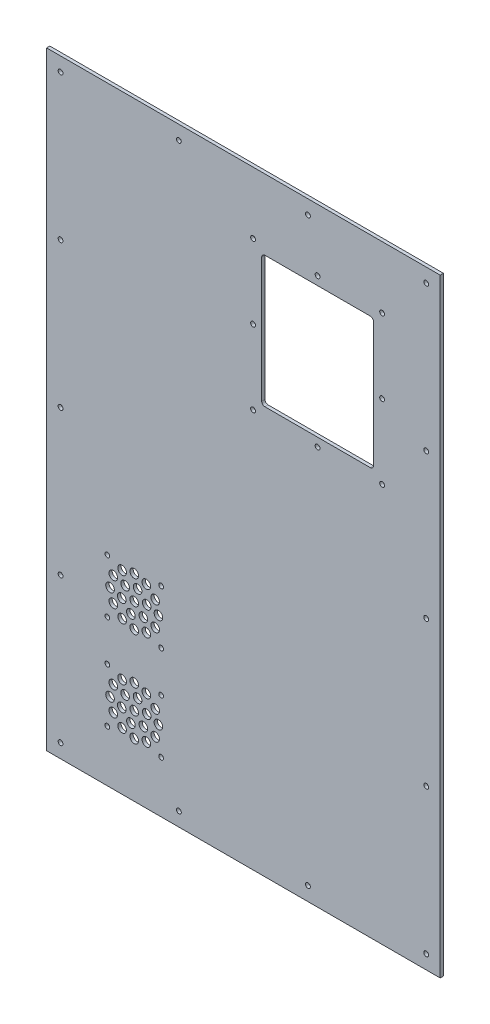
from build123d import *

# Parameters (mm, degrees)
SKETCH_1_W          = 366
SKETCH_1_H          = 566
EXTRUDE_1_DEPTH     = 3
SKETCH_5_R          = 2.25
CUT_EXTRUDE_2_DEPTH = 675.033381963
SKETCH_6_W          = 104
SKETCH_6_H          = 122
CUT_EXTRUDE_3_DEPTH = 675.033381963
SKETCH_7_R          = 2.25
CUT_EXTRUDE_4_DEPTH = 675.033381963
FILLET2_R           = 3
SKETCH_8_R          = 4
SKETCH_8_R_2        = 2.2
CUT_EXTRUDE_5_DEPTH = 675.033381963


with BuildPart() as part:
    # Эскиз1 → Бобышка-Вытянуть1 (new body)
    with BuildSketch(Plane.XY):
        with Locations((183, 283)):
            Rectangle(SKETCH_1_W, SKETCH_1_H)
    extrude(amount=EXTRUDE_1_DEPTH)

    # Эскиз5 → Вырез-Вытянуть2 (cut, through all)
    with BuildSketch(Plane(origin=(0, 0, 0), x_dir=(-1, 0, 0), z_dir=(0, 0, -1))):
        with Locations((-353, 553)):
            Circle(SKETCH_5_R)
        with Locations((-13, 553)):
            Circle(SKETCH_5_R)
        with Locations((-243, 553)):
            Circle(SKETCH_5_R)
        with Locations((-123, 553)):
            Circle(SKETCH_5_R)
        with Locations((-353, 418)):
            Circle(SKETCH_5_R)
        with Locations((-353, 283)):
            Circle(SKETCH_5_R)
        with Locations((-353, 148)):
            Circle(SKETCH_5_R)
        with Locations((-353, 13)):
            Circle(SKETCH_5_R)
        with Locations((-13, 418)):
            Circle(SKETCH_5_R)
        with Locations((-13, 283)):
            Circle(SKETCH_5_R)
        with Locations((-13, 148)):
            Circle(SKETCH_5_R)
        with Locations((-13, 13)):
            Circle(SKETCH_5_R)
        with Locations((-123, 13)):
            Circle(SKETCH_5_R)
        with Locations((-243, 13)):
            Circle(SKETCH_5_R)
    extrude(amount=-CUT_EXTRUDE_2_DEPTH, mode=Mode.SUBTRACT)

    # Эскиз6 → Вырез-Вытянуть3 (cut, through all)
    with BuildSketch(Plane.XY.offset(3)):
        with Locations((252, 439.5)):
            Rectangle(SKETCH_6_W, SKETCH_6_H)
    extrude(amount=-CUT_EXTRUDE_3_DEPTH, mode=Mode.SUBTRACT)

    # Эскиз7 → Вырез-Вытянуть4 (cut, through all)
    with BuildSketch(Plane.XY.offset(3)):
        with Locations((192, 370.5)):
            Circle(SKETCH_7_R)
        with Locations((192, 439.5)):
            Circle(SKETCH_7_R)
        with Locations((192, 508.5)):
            Circle(SKETCH_7_R)
        with Locations((252, 370.5)):
            Circle(SKETCH_7_R)
        with Locations((312, 370.5)):
            Circle(SKETCH_7_R)
        with Locations((252, 508.5)):
            Circle(SKETCH_7_R)
        with Locations((312, 508.5)):
            Circle(SKETCH_7_R)
        with Locations((312, 439.5)):
            Circle(SKETCH_7_R)
    extrude(amount=-CUT_EXTRUDE_4_DEPTH, mode=Mode.SUBTRACT)

    # Fillet2
    fillet2_edges = [part.edges().sort_by_distance(p)[0] for p in [
        (200, 378.5, 1.5),
        (304, 378.5, 1.5),
        (304, 500.5, 1.5),
        (200, 500.5, 1.5),
    ]]
    fillet(fillet2_edges, radius=FILLET2_R)

    # Эскиз8 → Вырез-Вытянуть5 (cut, through all)
    with BuildSketch(Plane(origin=(0, 0, 0), x_dir=(-1, 0, 0), z_dir=(0, 0, -1))):
        with Locations((-81.5, 138.5)):
            Circle(SKETCH_8_R)
        with Locations((-89.985281374, 152.514718626)):
            Circle(SKETCH_8_R)
        with Locations((-81.5, 161)):
            Circle(SKETCH_8_R)
        with Locations((-92.75, 141.514428415)):
            Circle(SKETCH_8_R)
        with Locations((-100.985571585, 149.75)):
            Circle(SKETCH_8_R)
        with Locations((-104, 161)):
            Circle(SKETCH_8_R)
        with Locations((-100.985571585, 172.25)):
            Circle(SKETCH_8_R)
        with Locations((-92.75, 180.485571585)):
            Circle(SKETCH_8_R)
        with Locations((-81.5, 183.5)):
            Circle(SKETCH_8_R)
        with Locations((-70.25, 180.485571585)):
            Circle(SKETCH_8_R)
        with Locations((-62.014428415, 172.25)):
            Circle(SKETCH_8_R)
        with Locations((-59, 161)):
            Circle(SKETCH_8_R)
        with Locations((-62.014428415, 149.75)):
            Circle(SKETCH_8_R)
        with Locations((-70.25, 141.514428415)):
            Circle(SKETCH_8_R)
        with Locations((-93.091109915, 164.105828541)):
            Circle(SKETCH_8_R)
        with Locations((-84.605828541, 172.591109915)):
            Circle(SKETCH_8_R)
        with Locations((-73.014718626, 169.485281374)):
            Circle(SKETCH_8_R)
        with Locations((-69.908890085, 157.894171459)):
            Circle(SKETCH_8_R)
        with Locations((-78.394171459, 149.408890085)):
            Circle(SKETCH_8_R)
        with Locations((-81.5, 73)):
            Circle(SKETCH_8_R)
        with Locations((-81.5, 50.5)):
            Circle(SKETCH_8_R)
        with Locations((-89.985281374, 64.514718626)):
            Circle(SKETCH_8_R)
        with Locations((-92.75, 53.514428415)):
            Circle(SKETCH_8_R)
        with Locations((-100.985571585, 61.75)):
            Circle(SKETCH_8_R)
        with Locations((-104, 73)):
            Circle(SKETCH_8_R)
        with Locations((-100.985571585, 84.25)):
            Circle(SKETCH_8_R)
        with Locations((-92.75, 92.485571585)):
            Circle(SKETCH_8_R)
        with Locations((-81.5, 95.5)):
            Circle(SKETCH_8_R)
        with Locations((-70.25, 92.485571585)):
            Circle(SKETCH_8_R)
        with Locations((-62.014428415, 84.25)):
            Circle(SKETCH_8_R)
        with Locations((-59, 73)):
            Circle(SKETCH_8_R)
        with Locations((-62.014428415, 61.75)):
            Circle(SKETCH_8_R)
        with Locations((-70.25, 53.514428415)):
            Circle(SKETCH_8_R)
        with Locations((-93.091109915, 76.105828541)):
            Circle(SKETCH_8_R)
        with Locations((-84.605828541, 84.591109915)):
            Circle(SKETCH_8_R)
        with Locations((-73.014718626, 81.485281374)):
            Circle(SKETCH_8_R)
        with Locations((-69.908890085, 69.894171459)):
            Circle(SKETCH_8_R)
        with Locations((-78.394171459, 61.408890085)):
            Circle(SKETCH_8_R)
        with Locations((-106.5, 186)):
            Circle(SKETCH_8_R_2)
        with Locations((-56.5, 186)):
            Circle(SKETCH_8_R_2)
        with Locations((-56.5, 136)):
            Circle(SKETCH_8_R_2)
        with Locations((-106.5, 136)):
            Circle(SKETCH_8_R_2)
        with Locations((-56.5, 98)):
            Circle(SKETCH_8_R_2)
        with Locations((-56.5, 48)):
            Circle(SKETCH_8_R_2)
        with Locations((-106.5, 48)):
            Circle(SKETCH_8_R_2)
        with Locations((-106.5, 98)):
            Circle(SKETCH_8_R_2)
    extrude(amount=-CUT_EXTRUDE_5_DEPTH, mode=Mode.SUBTRACT)


solid = part.part
